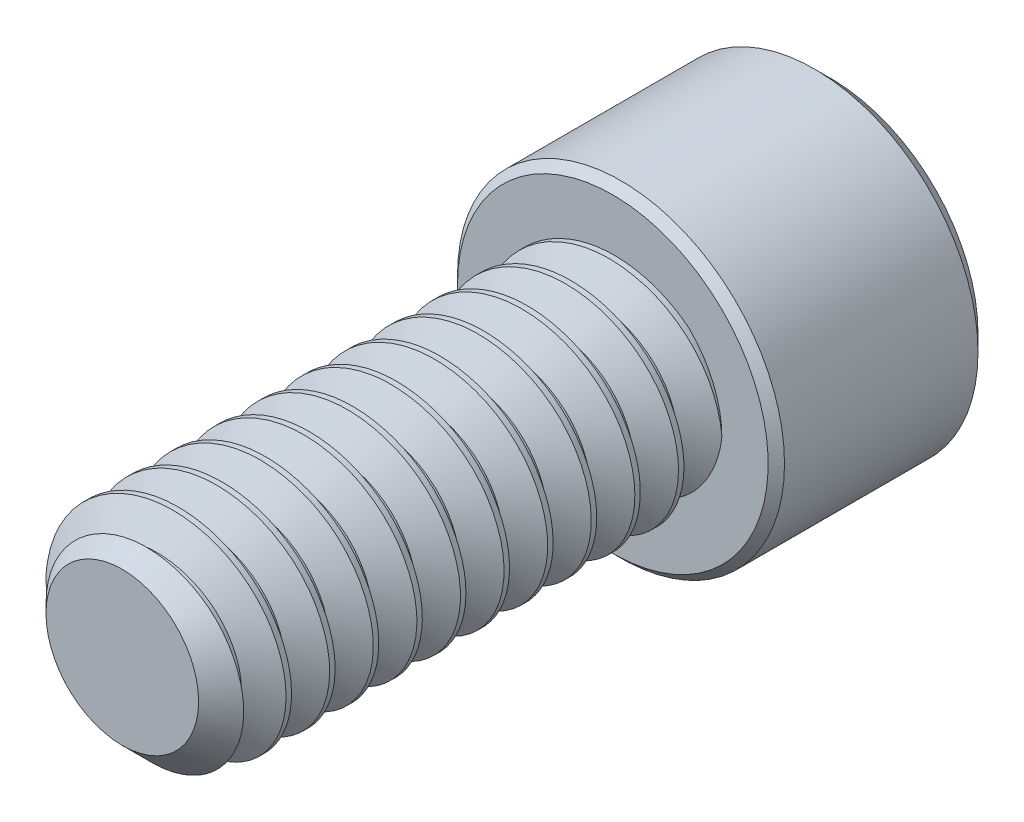
from build123d import *

# Parameters (mm, degrees)
SKETCH1_R          = 3.175
EXTRUDE1_DEPTH     = 14.2875
CHAMFER3_SIZE      = 0.9525
CUT_SWEEP1_PITCH   = 1.27
SKETCH6_R          = 4.7625
EXTRUDE2_DEPTH     = 6.35
CUT_EXTRUDE1_DEPTH = 3.571875
CHAMFER1_SIZE      = 0.47625
CHAMFER2_SIZE      = 0.238125


with BuildPart() as part:
    # Sketch1 → Extrude1 (new body)
    with BuildSketch(Plane.XY):
        Circle(SKETCH1_R)
    extrude(amount=-EXTRUDE1_DEPTH)

    # Chamfer3
    chamfer3_edges = [part.edges().sort_by_distance(p)[0] for p in [
        (-3.175, 0, 0),
    ]]
    chamfer(chamfer3_edges, length=CHAMFER3_SIZE)

    # Cut-Sweep1: the profile of Sketch3 profile screwed along a right-hand helix of 12.25 turns, 6 arcs to a turn; built about Z, then put on its axis
    cut_sweep1_z = Axis((0, 0, 0), (0, 0, 1))
    cut_sweep1_corners = [(3.1753, 0, -1.111423205), (2.350110803, 0, -0.635), (2.350110803, 0, -0.47625), (3.1753, 0, 0.000173205)]
    with BuildLine(mode=Mode.PRIVATE) as cut_sweep1_profile:
        Line(cut_sweep1_corners[0], cut_sweep1_corners[1])
        Line(cut_sweep1_corners[1], cut_sweep1_corners[2])
        Line(cut_sweep1_corners[2], cut_sweep1_corners[3])
        Line(cut_sweep1_corners[3], cut_sweep1_corners[0])
    cut_sweep1_cap = Face(cut_sweep1_profile.wire())
    cut_sweep1_turn_angles = [0, 30, 60, 90, 120, 150, 180, 210, 240, 270, 300, 330, 360]
    cut_sweep1_turn_weights = [1, 0.8660254037844387, 1, 0.8660254037844387, 1, 0.8660254037844387, 1, 0.8660254037844387, 1, 0.8660254037844387, 1, 0.8660254037844387, 1]
    cut_sweep1_turn_rails = [Edge.make_bspline([Vector(p[0], p[1], 0).rotate(cut_sweep1_z, cut_sweep1_turn_angles[k]) / cut_sweep1_turn_weights[k] + Vector(0, 0, p[2] + CUT_SWEEP1_PITCH * cut_sweep1_turn_angles[k] / 360) for k in range(13)], [0, 0, 0, 1, 1, 2, 2, 3, 3, 4, 4, 5, 5, 6, 6, 6], 2, cut_sweep1_turn_weights) for p in cut_sweep1_corners]
    cut_sweep1_turn_sides = [Face.make_surface_from_curves(cut_sweep1_turn_rails[p[0]], cut_sweep1_turn_rails[p[1]]) for p in [(0, 1), (1, 2), (2, 3), (3, 0)]]
    cut_sweep1_last_angles = [4320, 4350, 4380, 4395, 4410]
    cut_sweep1_last_weights = [1, 0.8660254037844387, 1, 0.9659258262890046, 1]
    cut_sweep1_last_rails = [Edge.make_bspline([Vector(p[0], p[1], 0).rotate(cut_sweep1_z, cut_sweep1_last_angles[k]) / cut_sweep1_last_weights[k] + Vector(0, 0, p[2] + CUT_SWEEP1_PITCH * cut_sweep1_last_angles[k] / 360) for k in range(5)], [0, 0, 0, 1, 1, 2, 2, 2], 2, cut_sweep1_last_weights) for p in cut_sweep1_corners]
    cut_sweep1_last_sides = [Face.make_surface_from_curves(cut_sweep1_last_rails[p[0]], cut_sweep1_last_rails[p[1]]) for p in [(0, 1), (1, 2), (2, 3), (3, 0)]]
    cut_sweep1 = Plane(origin=(0, 0, 0), x_dir=(0, 1, 0), z_dir=(0, 0, -1)) * Solid(Shell([*[p.moved(Location((0, 0, CUT_SWEEP1_PITCH * i))) for i in range(12) for p in cut_sweep1_turn_sides], *cut_sweep1_last_sides, cut_sweep1_cap, cut_sweep1_cap.rotate(cut_sweep1_z, 4410).moved(Location((0, 0, CUT_SWEEP1_PITCH * 4410 / 360)))]))
    add(cut_sweep1, mode=Mode.SUBTRACT)

    # Sketch6 → Extrude2 (add)
    with BuildSketch(Plane(origin=(0, 0, -14.2875), x_dir=(-1, 0, 0), z_dir=(0, 0, -1))):
        Circle(SKETCH6_R)
    extrude(amount=EXTRUDE2_DEPTH)

    # Sketch7 → Cut-Extrude1 (cut)
    with BuildSketch(Plane(origin=(0, 0, -20.6375), x_dir=(-1, 0, 0), z_dir=(0, 0, -1))):
        Polygon((0, 2.749630657), (-2.38125, 1.374815329), (-2.38125, -1.374815329), (0, -2.749630657), (2.38125, -1.374815329), (2.38125, 1.374815329), align=None)
    extrude(amount=-CUT_EXTRUDE1_DEPTH, mode=Mode.SUBTRACT)

    # Cut-Extrude2 cone 1 section (through the dimple's axis) → Cut-Extrude2 (revolve, cut)
    with BuildSketch(Plane(origin=(0, 0, -20.6375), x_dir=(0, 1, 0), z_dir=(1, 0, 0))):
        Polygon((0, 0), (2.749630657, 0), (0, 2.749630657), align=None)
    revolve(axis=Axis((0, 0, -20.6375), (0, 0, 1)), mode=Mode.SUBTRACT)

    # Chamfer1
    chamfer1_edges = [part.edges().sort_by_distance(p)[0] for p in [
        (4.7625, 0, -20.6375),
    ]]
    chamfer(chamfer1_edges, length=CHAMFER1_SIZE)

    # Chamfer2
    chamfer2_edges = [part.edges().sort_by_distance(p)[0] for p in [
        (4.7625, 0, -14.2875),
    ]]
    chamfer(chamfer2_edges, length=CHAMFER2_SIZE)


solid = part.part
